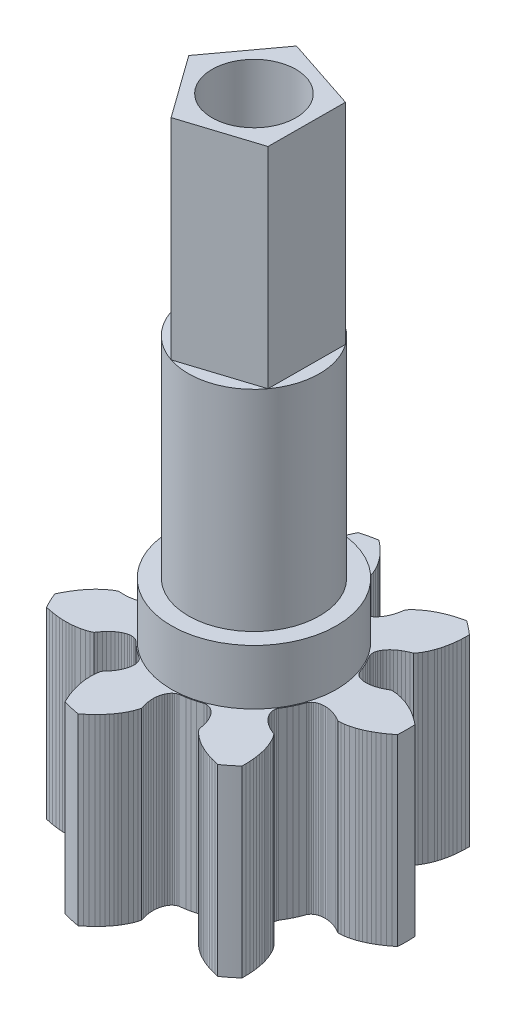
from build123d import *

# Parameters (mm, degrees)
SKETCH1_R           = 3.15
BOSS_EXTRUDE1_DEPTH = 2.1
SKETCH2_R           = 2.5
BOSS_EXTRUDE3_DEPTH = 16
BOSS_EXTRUDE4_DEPTH = 7
SKETCH3_R           = 1.1
SKETCH3_R_2         = 0.75
CUT_EXTRUDE2_DEPTH  = 20.858328167
SKETCH6_R           = 1.7
CUT_EXTRUDE3_DEPTH  = 7.6
SKETCH7_R           = 1.6
CUT_EXTRUDE4_DEPTH  = 20.313031807
SKETCH8_OUTSIDE_W   = 19.149
SKETCH8_OUTSIDE_H   = 19.428
CUT_EXTRUDE5_DEPTH  = 8


with BuildPart() as part:
    # Sketch1 → Boss-Extrude1 (new body)
    with BuildSketch(Plane(origin=(0, 0, 0), x_dir=(1, 0, 0), z_dir=(0, 1, 0))):
        with Locations(Location((0, 0, 0), (0, 0, 270))):
            Circle(SKETCH1_R)
    extrude(amount=BOSS_EXTRUDE1_DEPTH)

    # Sketch2 → Boss-Extrude3 (add)
    with BuildSketch(Plane(origin=(0, 2.1, 0), x_dir=(1, 0, 0), z_dir=(0, 1, 0))):
        with Locations(Location((0, 0, 0), (0, 0, 270))):
            Circle(SKETCH2_R)
    extrude(amount=BOSS_EXTRUDE3_DEPTH)

    # Sketch4 → Boss-Extrude4 (add)
    with BuildSketch(Plane.XZ):
        with BuildLine():
            Line((-1.677656104, -5.457545802), (-1.740166904, -5.314388502))
            Line((-1.740166904, -5.314388502), (-1.793915704, -5.175673402))
            Line((-1.793915704, -5.175673402), (-1.839244704, -5.042342702))
            Line((-1.839244704, -5.042342702), (-1.876421604, -4.915999102))
            Line((-1.876421604, -4.915999102), (-1.907053904, -4.793237402))
            Line((-1.907053904, -4.793237402), (-1.931099704, -4.676009702))
            Line((-1.931099704, -4.676009702), (-1.948773704, -4.566830802))
            Line((-1.948773704, -4.566830802), (-1.961024804, -4.464035702))
            Line((-1.961024804, -4.464035702), (-1.971502404, -4.279785302))
            Line((-1.971502404, -4.279785302), (-1.967365804, -4.124635702))
            Line((-1.967365804, -4.124635702), (-1.953730504, -4.000928102))
            Line((-1.953730504, -4.000928102), (-1.930260404, -3.886700602))
            Line((-1.930260404, -3.886700602), (-1.859391804, -3.809735002))
            Line((-1.859391804, -3.809735002), (-1.778417204, -3.712510502))
            Line((-1.778417204, -3.712510502), (-1.708697804, -3.615493902))
            Line((-1.708697804, -3.615493902), (-1.650076104, -3.519450202))
            Line((-1.650076104, -3.519450202), (-1.602332404, -3.425130202))
            Line((-1.602332404, -3.425130202), (-1.565200104, -3.333258302))
            Line((-1.565200104, -3.333258302), (-1.538382904, -3.244569502))
            Line((-1.538382904, -3.244569502), (-1.521548504, -3.159737902))
            Line((-1.521548504, -3.159737902), (-1.514299404, -3.079451802))
            Line((-1.514299404, -3.079451802), (-1.516222204, -3.004347502))
            Line((-1.516222204, -3.004347502), (-1.526863004, -2.935043002))
            Line((-1.526863004, -2.935043002), (-1.545721204, -2.872129302))
            Line((-1.545721204, -2.872129302), (-1.572279104, -2.816160102))
            Line((-1.572279104, -2.816160102), (-1.605971904, -2.767662302))
            Line((-1.605971904, -2.767662302), (-1.657232504, -2.718290402))
            Line((-1.657232504, -2.718290402), (-1.844744204, -2.592775302))
            Line((-1.844744204, -2.592775302), (-1.984007204, -2.487817902))
            Line((-1.984007204, -2.487817902), (-2.117322004, -2.375401802))
            Line((-2.117322004, -2.375401802), (-2.281415504, -2.220521102))
            Line((-2.281415504, -2.220521102), (-2.340956004, -2.181532002))
            Line((-2.340956004, -2.181532002), (-2.395735304, -2.159475702))
            Line((-2.395735304, -2.159475702), (-2.456210904, -2.146038102))
            Line((-2.456210904, -2.146038102), (-2.521743604, -2.141652302))
            Line((-2.521743604, -2.141652302), (-2.591678304, -2.146699902))
            Line((-2.591678304, -2.146699902), (-2.665327304, -2.161537602))
            Line((-2.665327304, -2.161537602), (-2.741987504, -2.186470302))
            Line((-2.741987504, -2.186470302), (-2.820946104, -2.221759402))
            Line((-2.820946104, -2.221759402), (-2.901443904, -2.267639402))
            Line((-2.901443904, -2.267639402), (-2.982749704, -2.324284202))
            Line((-2.982749704, -2.324284202), (-3.064080904, -2.391819002))
            Line((-3.064080904, -2.391819002), (-3.144672004, -2.470342602))
            Line((-3.144672004, -2.470342602), (-3.223742204, -2.559902302))
            Line((-3.223742204, -2.559902302), (-3.300510504, -2.660481102))
            Line((-3.300510504, -2.660481102), (-3.359776704, -2.746699402))
            Line((-3.359776704, -2.746699402), (-3.465917704, -2.794999002))
            Line((-3.465917704, -2.794999002), (-3.583489604, -2.835820002))
            Line((-3.583489604, -2.835820002), (-3.733828804, -2.874377002))
            Line((-3.733828804, -2.874377002), (-3.915791104, -2.905161502))
            Line((-3.915791104, -2.905161502), (-4.018735004, -2.916091602))
            Line((-4.018735004, -2.916091602), (-4.129109504, -2.923155402))
            Line((-4.129109504, -2.923155402), (-4.248748704, -2.925798102))
            Line((-4.248748704, -2.925798102), (-4.375248804, -2.923250802))
            Line((-4.375248804, -2.923250802), (-4.506697404, -2.915120202))
            Line((-4.506697404, -2.915120202), (-4.646771904, -2.900596502))
            Line((-4.646771904, -2.900596502), (-4.793969404, -2.879062302))
            Line((-4.793969404, -2.879062302), (-4.947447304, -2.849974302))
            Line((-4.947447304, -2.849974302), (-5.090225304, -2.816749202))
            ThreePointArc((-5.090225304, -2.816749202), (-5.241476502, -2.524161997), (-5.375926806, -2.223483907))
            Line((-5.375926806, -2.223483907), (-5.312882596, -2.091140098))
            Line((-5.312882596, -2.091140098), (-5.239932596, -1.953010098))
            Line((-5.239932596, -1.953010098), (-5.164992596, -1.824500098))
            Line((-5.164992596, -1.824500098), (-5.089012596, -1.705930098))
            Line((-5.089012596, -1.705930098), (-5.013412596, -1.598090098))
            Line((-5.013412596, -1.598090098), (-4.936532596, -1.497600098))
            Line((-4.936532596, -1.497600098), (-4.859872596, -1.405710098))
            Line((-4.859872596, -1.405710098), (-4.785532596, -1.323820098))
            Line((-4.785532596, -1.323820098), (-4.712802596, -1.250150098))
            Line((-4.712802596, -1.250150098), (-4.575282596, -1.127080098))
            Line((-4.575282596, -1.127080098), (-4.451402596, -1.033580098))
            Line((-4.451402596, -1.033580098), (-4.346182596, -0.967110098))
            Line((-4.346182596, -0.967110098), (-4.242242596, -0.914240098))
            Line((-4.242242596, -0.914240098), (-4.137882596, -0.921660098))
            Line((-4.137882596, -0.921660098), (-4.011382596, -0.924350098))
            Line((-4.011382596, -0.924350098), (-3.892062596, -0.918370098))
            Line((-3.892062596, -0.918370098), (-3.780422596, -0.904320098))
            Line((-3.780422596, -0.904320098), (-3.676912596, -0.882840098))
            Line((-3.676912596, -0.882840098), (-3.581932596, -0.854590098))
            Line((-3.581932596, -0.854590098), (-3.495872596, -0.820260098))
            Line((-3.495872596, -0.820260098), (-3.419052596, -0.780530098))
            Line((-3.419052596, -0.780530098), (-3.351762596, -0.736140098))
            Line((-3.351762596, -0.736140098), (-3.294242596, -0.687810098))
            Line((-3.294242596, -0.687810098), (-3.246692596, -0.636280098))
            Line((-3.246692596, -0.636280098), (-3.209262596, -0.582310098))
            Line((-3.209262596, -0.582310098), (-3.182062596, -0.526650098))
            Line((-3.182062596, -0.526650098), (-3.165152596, -0.470070098))
            Line((-3.165152596, -0.470070098), (-3.158512596, -0.399210098))
            Line((-3.158512596, -0.399210098), (-3.177292596, -0.174350098))
            Line((-3.177292596, -0.174350098), (-3.182062596, -3.0098e-05))
            Line((-3.182062596, -3.0098e-05), (-3.177292596, 0.174289902))
            Line((-3.177292596, 0.174289902), (-3.158512596, 0.399149902))
            Line((-3.158512596, 0.399149902), (-3.165152596, 0.470009902))
            Line((-3.165152596, 0.470009902), (-3.182062596, 0.526589902))
            Line((-3.182062596, 0.526589902), (-3.209262596, 0.582249902))
            Line((-3.209262596, 0.582249902), (-3.246692596, 0.636219902))
            Line((-3.246692596, 0.636219902), (-3.294242596, 0.687749902))
            Line((-3.294242596, 0.687749902), (-3.351762596, 0.736079902))
            Line((-3.351762596, 0.736079902), (-3.419052596, 0.780469902))
            Line((-3.419052596, 0.780469902), (-3.495872596, 0.820199902))
            Line((-3.495872596, 0.820199902), (-3.581932596, 0.854529902))
            Line((-3.581932596, 0.854529902), (-3.676912596, 0.882779902))
            Line((-3.676912596, 0.882779902), (-3.780422596, 0.904259902))
            Line((-3.780422596, 0.904259902), (-3.892062596, 0.918309902))
            Line((-3.892062596, 0.918309902), (-4.011382596, 0.924289902))
            Line((-4.011382596, 0.924289902), (-4.137882596, 0.921599902))
            Line((-4.137882596, 0.921599902), (-4.242242596, 0.914179902))
            Line((-4.242242596, 0.914179902), (-4.346182596, 0.967049902))
            Line((-4.346182596, 0.967049902), (-4.451402596, 1.033519902))
            Line((-4.451402596, 1.033519902), (-4.575282596, 1.127019902))
            Line((-4.575282596, 1.127019902), (-4.712802596, 1.250089902))
            Line((-4.712802596, 1.250089902), (-4.785532596, 1.323759902))
            Line((-4.785532596, 1.323759902), (-4.859872596, 1.405649902))
            Line((-4.859872596, 1.405649902), (-4.936532596, 1.497539902))
            Line((-4.936532596, 1.497539902), (-5.013412596, 1.598029902))
            Line((-5.013412596, 1.598029902), (-5.089012596, 1.705869902))
            Line((-5.089012596, 1.705869902), (-5.164992596, 1.824439902))
            Line((-5.164992596, 1.824439902), (-5.239932596, 1.952949902))
            Line((-5.239932596, 1.952949902), (-5.312882596, 2.091079902))
            Line((-5.312882596, 2.091079902), (-5.375926796, 2.223423702))
            ThreePointArc((-5.375926796, 2.223423702), (-5.241476491, 2.524101771), (-5.090225294, 2.816688957))
            Line((-5.090225294, 2.816688957), (-4.947447286, 2.849914054))
            Line((-4.947447286, 2.849914054), (-4.793969386, 2.879002054))
            Line((-4.793969386, 2.879002054), (-4.646771886, 2.900536254))
            Line((-4.646771886, 2.900536254), (-4.506697386, 2.915059954))
            Line((-4.506697386, 2.915059954), (-4.375248786, 2.923190554))
            Line((-4.375248786, 2.923190554), (-4.248748686, 2.925737854))
            Line((-4.248748686, 2.925737854), (-4.129109486, 2.923095154))
            Line((-4.129109486, 2.923095154), (-4.018734986, 2.916031354))
            Line((-4.018734986, 2.916031354), (-3.915791086, 2.905101254))
            Line((-3.915791086, 2.905101254), (-3.733828786, 2.874316754))
            Line((-3.733828786, 2.874316754), (-3.583489586, 2.835759754))
            Line((-3.583489586, 2.835759754), (-3.465917686, 2.794938754))
            Line((-3.465917686, 2.794938754), (-3.359776686, 2.746639154))
            Line((-3.359776686, 2.746639154), (-3.300510486, 2.660420854))
            Line((-3.300510486, 2.660420854), (-3.223742186, 2.559842054))
            Line((-3.223742186, 2.559842054), (-3.144671986, 2.470282354))
            Line((-3.144671986, 2.470282354), (-3.064080886, 2.391758754))
            Line((-3.064080886, 2.391758754), (-2.982749686, 2.324223954))
            Line((-2.982749686, 2.324223954), (-2.901443886, 2.267579154))
            Line((-2.901443886, 2.267579154), (-2.820946086, 2.221699154))
            Line((-2.820946086, 2.221699154), (-2.741987486, 2.186410054))
            Line((-2.741987486, 2.186410054), (-2.665327286, 2.161477354))
            Line((-2.665327286, 2.161477354), (-2.591678286, 2.146639654))
            Line((-2.591678286, 2.146639654), (-2.521743586, 2.141592054))
            Line((-2.521743586, 2.141592054), (-2.456210886, 2.145977854))
            Line((-2.456210886, 2.145977854), (-2.395735286, 2.159415454))
            Line((-2.395735286, 2.159415454), (-2.340955986, 2.181471754))
            Line((-2.340955986, 2.181471754), (-2.281415486, 2.220460854))
            Line((-2.281415486, 2.220460854), (-2.117321986, 2.375341554))
            Line((-2.117321986, 2.375341554), (-1.984007186, 2.487757654))
            Line((-1.984007186, 2.487757654), (-1.844744186, 2.592715054))
            Line((-1.844744186, 2.592715054), (-1.657232486, 2.718230154))
            Line((-1.657232486, 2.718230154), (-1.605971886, 2.767602054))
            Line((-1.605971886, 2.767602054), (-1.572279086, 2.816099854))
            Line((-1.572279086, 2.816099854), (-1.545721186, 2.872069054))
            Line((-1.545721186, 2.872069054), (-1.526862986, 2.934982754))
            Line((-1.526862986, 2.934982754), (-1.516222186, 3.004287254))
            Line((-1.516222186, 3.004287254), (-1.514299386, 3.079391554))
            Line((-1.514299386, 3.079391554), (-1.521548486, 3.159677654))
            Line((-1.521548486, 3.159677654), (-1.538382886, 3.244509254))
            Line((-1.538382886, 3.244509254), (-1.565200086, 3.333198054))
            Line((-1.565200086, 3.333198054), (-1.602332386, 3.425069954))
            Line((-1.602332386, 3.425069954), (-1.650076086, 3.519389954))
            Line((-1.650076086, 3.519389954), (-1.708697786, 3.615433654))
            Line((-1.708697786, 3.615433654), (-1.778417186, 3.712450254))
            Line((-1.778417186, 3.712450254), (-1.859391786, 3.809674754))
            Line((-1.859391786, 3.809674754), (-1.930260386, 3.886640354))
            Line((-1.930260386, 3.886640354), (-1.953730486, 4.000867854))
            Line((-1.953730486, 4.000867854), (-1.967365786, 4.124575454))
            Line((-1.967365786, 4.124575454), (-1.971502386, 4.279725054))
            Line((-1.971502386, 4.279725054), (-1.961024786, 4.463975454))
            Line((-1.961024786, 4.463975454), (-1.948773686, 4.566770554))
            Line((-1.948773686, 4.566770554), (-1.931099686, 4.675949454))
            Line((-1.931099686, 4.675949454), (-1.907053886, 4.793177154))
            Line((-1.907053886, 4.793177154), (-1.876421586, 4.915938854))
            Line((-1.876421586, 4.915938854), (-1.839244686, 5.042282454))
            Line((-1.839244686, 5.042282454), (-1.793915686, 5.175613154))
            Line((-1.793915686, 5.175613154), (-1.740166886, 5.314328254))
            Line((-1.740166886, 5.314328254), (-1.677656086, 5.457485554))
            Line((-1.677656086, 5.457485554), (-1.613492886, 5.589290554))
            ThreePointArc((-1.613492886, 5.589290554), (-1.294584924, 5.671642777), (-0.971527485, 5.735814951))
            Line((-0.971527485, 5.735814951), (-0.856530379, 5.644902123))
            Line((-0.856530379, 5.644902123), (-0.738096579, 5.543044323))
            Line((-0.738096579, 5.543044323), (-0.629484279, 5.441387023))
            Line((-0.629484279, 5.441387023), (-0.530794179, 5.340927723))
            Line((-0.530794179, 5.340927723), (-0.442480579, 5.243226523))
            Line((-0.442480579, 5.243226523), (-0.361617479, 5.145912923))
            Line((-0.361617479, 5.145912923), (-0.289089779, 5.050727423))
            Line((-0.289089779, 5.050727423), (-0.225795179, 4.960029123))
            Line((-0.225795179, 4.960029123), (-0.170156179, 4.872729423))
            Line((-0.170156179, 4.872729423), (-0.080772879, 4.711271723))
            Line((-0.080772879, 4.711271723), (-0.017182979, 4.569691923))
            Line((-0.017182979, 4.569691923), (0.024206821, 4.452319023))
            Line((0.024206821, 4.452319023), (0.052622421, 4.339220423))
            Line((0.052622421, 4.339220423), (0.022166221, 4.239128023))
            Line((0.022166221, 4.239128023), (-0.008605279, 4.116398223))
            Line((-0.008605279, 4.116398223), (-0.029326379, 3.998739123))
            Line((-0.029326379, 3.998739123), (-0.040470879, 3.886771723))
            Line((-0.040470879, 3.886771723), (-0.042562579, 3.781077223))
            Line((-0.042562579, 3.781077223), (-0.036155879, 3.682192323))
            Line((-0.036155879, 3.682192323), (-0.021836779, 3.590650923))
            Line((-0.021836779, 3.590650923), (-0.000196979, 3.506916223))
            Line((-0.000196979, 3.506916223), (0.028106621, 3.431435623))
            Line((0.028106621, 3.431435623), (0.062425521, 3.364603323))
            Line((0.062425521, 3.364603323), (0.102082621, 3.306779023))
            Line((0.102082621, 3.306779023), (0.146370621, 3.258277923))
            Line((0.146370621, 3.258277923), (0.194582521, 3.219374423))
            Line((0.194582521, 3.219374423), (0.245981121, 3.190298123))
            Line((0.245981121, 3.190298123), (0.313586921, 3.168056823))
            Line((0.313586921, 3.168056823), (0.536988121, 3.136329923))
            Line((0.536988121, 3.136329923), (0.707999021, 3.102190423))
            Line((0.707999021, 3.102190423), (0.876887021, 3.058750223))
            Line((0.876887021, 3.058750223), (1.091930421, 2.990405023))
            Line((1.091930421, 2.990405023), (1.162491321, 2.981110623))
            Line((1.162491321, 2.981110623), (1.221415521, 2.985006423))
            Line((1.221415521, 2.985006423), (1.281732621, 2.999139023))
            Line((1.281732621, 2.999139023), (1.342678421, 3.023621123))
            Line((1.342678421, 3.023621123), (1.403497321, 3.058512423))
            Line((1.403497321, 3.058512423), (1.463415021, 3.103835823))
            Line((1.463415021, 3.103835823), (1.521665521, 3.159561023))
            Line((1.521665521, 3.159561023), (1.577493421, 3.225614223))
            Line((1.577493421, 3.225614223), (1.630112821, 3.301877423))
            Line((1.630112821, 3.301877423), (1.678789621, 3.388189823))
            Line((1.678789621, 3.388189823), (1.722764221, 3.484324823))
            Line((1.722764221, 3.484324823), (1.761304221, 3.590039423))
            Line((1.761304221, 3.590039423), (1.793685421, 3.705037123))
            Line((1.793685421, 3.705037123), (1.819211821, 3.828964023))
            Line((1.819211821, 3.828964023), (1.835200121, 3.932358623))
            Line((1.835200121, 3.932358623), (1.909873421, 4.021928023))
            Line((1.909873421, 4.021928023), (1.998090521, 4.109718923))
            Line((1.998090521, 4.109718923), (2.116812121, 4.209687323))
            Line((2.116812121, 4.209687323), (2.267397621, 4.316373723))
            Line((2.267397621, 4.316373723), (2.355404521, 4.370887123))
            Line((2.355404521, 4.370887123), (2.451783521, 4.425141023))
            Line((2.451783521, 4.425141023), (2.558428121, 4.479431523))
            Line((2.558428121, 4.479431523), (2.673506021, 4.532022823))
            Line((2.673506021, 4.532022823), (2.795464821, 4.581730723))
            Line((2.795464821, 4.581730723), (2.927969221, 4.629421523))
            Line((2.927969221, 4.629421523), (3.069932921, 4.673886423))
            Line((3.069932921, 4.673886423), (3.220832621, 4.714270623))
            Line((3.220832621, 4.714270623), (3.363886921, 4.746284823))
            ThreePointArc((3.363886921, 4.746284823), (3.627108363, 4.548298309), (3.878703226, 4.335732528))
            Line((3.878703226, 4.335732528), (3.879324236, 4.189141042))
            Line((3.879324236, 4.189141042), (3.873530936, 4.033038442))
            Line((3.873530936, 4.033038442), (3.861770736, 3.884739642))
            Line((3.861770736, 3.884739642), (3.844760636, 3.744945242))
            Line((3.844760636, 3.744945242), (3.823437436, 3.614983242))
            Line((3.823437436, 3.614983242), (3.797771936, 3.491087842))
            Line((3.797771936, 3.491087842), (3.768573236, 3.375036342))
            Line((3.768573236, 3.375036342), (3.737125936, 3.269001042))
            Line((3.737125936, 3.269001042), (3.703562736, 3.171070342))
            Line((3.703562736, 3.171070342), (3.633059536, 3.000520342))
            Line((3.633059536, 3.000520342), (3.562015636, 2.862530242))
            Line((3.562015636, 2.862530242), (3.496055936, 2.756989642))
            Line((3.496055936, 2.756989642), (3.425348736, 2.664257542))
            Line((3.425348736, 2.664257542), (3.328104136, 2.625662642))
            Line((3.328104136, 2.625662642), (3.212964436, 2.573199942))
            Line((3.212964436, 2.573199942), (3.108055436, 2.516041142))
            Line((3.108055436, 2.516041142), (3.013567336, 2.454943742))
            Line((3.013567336, 2.454943742), (2.929627936, 2.390679642))
            Line((2.929627936, 2.390679642), (2.856311136, 2.324016942))
            Line((2.856311136, 2.324016942), (2.793668936, 2.255746642))
            Line((2.793668936, 2.255746642), (2.741694736, 2.186620242))
            Line((2.741694736, 2.186620242), (2.700328636, 2.117430142))
            Line((2.700328636, 2.117430142), (2.669474536, 2.048929342))
            Line((2.669474536, 2.048929342), (2.648991436, 1.981871242))
            Line((2.648991436, 1.981871242), (2.638684936, 1.917005642))
            Line((2.638684936, 1.917005642), (2.638328536, 1.855056142))
            Line((2.638328536, 1.855056142), (2.647642236, 1.796742342))
            Line((2.647642236, 1.796742342), (2.672404836, 1.730018642))
            Line((2.672404836, 1.730018642), (2.786888136, 1.535575142))
            Line((2.786888136, 1.535575142), (2.866820336, 1.380587942))
            Line((2.866820336, 1.380587942), (2.938157336, 1.221461342))
            Line((2.938157336, 1.221461342), (3.018800236, 1.010721142))
            Line((3.018800236, 1.010721142), (3.055527736, 0.949759542))
            Line((3.055527736, 0.949759542), (3.095312236, 0.906119642))
            Line((3.095312236, 0.906119642), (3.143968536, 0.867773342))
            Line((3.143968536, 0.867773342), (3.201108536, 0.835388342))
            Line((3.201108536, 0.835388342), (3.266307636, 0.809592642))
            Line((3.266307636, 0.809592642), (3.339100936, 0.791005742))
            Line((3.339100936, 0.791005742), (3.418987236, 0.780207842))
            Line((3.418987236, 0.780207842), (3.505437836, 0.777743242))
            Line((3.505437836, 0.777743242), (3.597870436, 0.784153042))
            Line((3.597870436, 0.784153042), (3.695701736, 0.799910942))
            Line((3.695701736, 0.799910942), (3.798280836, 0.825469442))
            Line((3.798280836, 0.825469442), (3.904961036, 0.861249642))
            Line((3.904961036, 0.861249642), (4.015059336, 0.907632842))
            Line((4.015059336, 0.907632842), (4.127864736, 0.964942742))
            Line((4.127864736, 0.964942742), (4.218670436, 1.016908042))
            Line((4.218670436, 1.016908042), (4.335256536, 1.014371642))
            Line((4.335256536, 1.014371642), (4.458896736, 1.000137542))
            Line((4.458896736, 1.000137542), (4.611076836, 0.969646442))
            Line((4.611076836, 0.969646442), (4.788376236, 0.918431942))
            Line((4.788376236, 0.918431942), (4.885867836, 0.883613842))
            Line((4.885867836, 0.883613842), (4.988376636, 0.842088442))
            Line((4.988376636, 0.842088442), (5.097314536, 0.792559942))
            Line((5.097314536, 0.792559942), (5.210181936, 0.735378542))
            Line((5.210181936, 0.735378542), (5.325085236, 0.671019742))
            Line((5.325085236, 0.671019742), (5.444986436, 0.597158342))
            Line((5.444986436, 0.597158342), (5.568263436, 0.513890042))
            Line((5.568263436, 0.513890042), (5.693921436, 0.421091042))
            Line((5.693921436, 0.421091042), (5.808144136, 0.329207242))
            ThreePointArc((5.808144136, 0.329207242), (5.817467929, -3.016e-05), (5.808144136, -0.329267562))
            Line((5.808144136, -0.329267562), (5.693921429, -0.421151358))
            Line((5.693921429, -0.421151358), (5.568263429, -0.513950358))
            Line((5.568263429, -0.513950358), (5.444986429, -0.597218658))
            Line((5.444986429, -0.597218658), (5.325085229, -0.671080058))
            Line((5.325085229, -0.671080058), (5.210181929, -0.735438858))
            Line((5.210181929, -0.735438858), (5.097314529, -0.792620258))
            Line((5.097314529, -0.792620258), (4.988376629, -0.842148758))
            Line((4.988376629, -0.842148758), (4.885867829, -0.883674158))
            Line((4.885867829, -0.883674158), (4.788376229, -0.918492258))
            Line((4.788376229, -0.918492258), (4.611076829, -0.969706758))
            Line((4.611076829, -0.969706758), (4.458896729, -1.000197858))
            Line((4.458896729, -1.000197858), (4.335256529, -1.014431958))
            Line((4.335256529, -1.014431958), (4.218670429, -1.016968358))
            Line((4.218670429, -1.016968358), (4.127864729, -0.965003058))
            Line((4.127864729, -0.965003058), (4.015059329, -0.907693158))
            Line((4.015059329, -0.907693158), (3.904961029, -0.861309958))
            Line((3.904961029, -0.861309958), (3.798280829, -0.825529758))
            Line((3.798280829, -0.825529758), (3.695701729, -0.799971258))
            Line((3.695701729, -0.799971258), (3.597870429, -0.784213358))
            Line((3.597870429, -0.784213358), (3.505437829, -0.777803558))
            Line((3.505437829, -0.777803558), (3.418987229, -0.780268158))
            Line((3.418987229, -0.780268158), (3.339100929, -0.791066058))
            Line((3.339100929, -0.791066058), (3.266307629, -0.809652958))
            Line((3.266307629, -0.809652958), (3.201108529, -0.835448658))
            Line((3.201108529, -0.835448658), (3.143968529, -0.867833658))
            Line((3.143968529, -0.867833658), (3.095312229, -0.906179958))
            Line((3.095312229, -0.906179958), (3.055527729, -0.949819858))
            Line((3.055527729, -0.949819858), (3.018800229, -1.010781458))
            Line((3.018800229, -1.010781458), (2.938157329, -1.221521658))
            Line((2.938157329, -1.221521658), (2.866820329, -1.380648258))
            Line((2.866820329, -1.380648258), (2.786888129, -1.535635458))
            Line((2.786888129, -1.535635458), (2.672404829, -1.730078958))
            Line((2.672404829, -1.730078958), (2.647642229, -1.796802658))
            Line((2.647642229, -1.796802658), (2.638328529, -1.855116458))
            Line((2.638328529, -1.855116458), (2.638684929, -1.917065958))
            Line((2.638684929, -1.917065958), (2.648991429, -1.981931558))
            Line((2.648991429, -1.981931558), (2.669474529, -2.048989658))
            Line((2.669474529, -2.048989658), (2.700328629, -2.117490458))
            Line((2.700328629, -2.117490458), (2.741694729, -2.186680558))
            Line((2.741694729, -2.186680558), (2.793668929, -2.255806958))
            Line((2.793668929, -2.255806958), (2.856311129, -2.324077258))
            Line((2.856311129, -2.324077258), (2.929627929, -2.390739958))
            Line((2.929627929, -2.390739958), (3.013567329, -2.455004058))
            Line((3.013567329, -2.455004058), (3.108055429, -2.516101458))
            Line((3.108055429, -2.516101458), (3.212964429, -2.573260258))
            Line((3.212964429, -2.573260258), (3.328104129, -2.625722958))
            Line((3.328104129, -2.625722958), (3.425348729, -2.664317858))
            Line((3.425348729, -2.664317858), (3.496055929, -2.757049958))
            Line((3.496055929, -2.757049958), (3.562015629, -2.862590558))
            Line((3.562015629, -2.862590558), (3.633059529, -3.000580658))
            Line((3.633059529, -3.000580658), (3.703562729, -3.171130658))
            Line((3.703562729, -3.171130658), (3.737125929, -3.269061358))
            Line((3.737125929, -3.269061358), (3.768573229, -3.375096658))
            Line((3.768573229, -3.375096658), (3.797771929, -3.491148158))
            Line((3.797771929, -3.491148158), (3.823437429, -3.615043558))
            Line((3.823437429, -3.615043558), (3.844760629, -3.745005558))
            Line((3.844760629, -3.745005558), (3.861770729, -3.884799958))
            Line((3.861770729, -3.884799958), (3.873530929, -4.033098758))
            Line((3.873530929, -4.033098758), (3.879324229, -4.189201358))
            Line((3.879324229, -4.189201358), (3.878703229, -4.335792858))
            ThreePointArc((3.878703229, -4.335792858), (3.627108367, -4.548358644), (3.363886927, -4.746345161))
            Line((3.363886927, -4.746345161), (3.220832594, -4.714330914))
            Line((3.220832594, -4.714330914), (3.069932894, -4.673946714))
            Line((3.069932894, -4.673946714), (2.927969194, -4.629481814))
            Line((2.927969194, -4.629481814), (2.795464794, -4.581791014))
            Line((2.795464794, -4.581791014), (2.673505994, -4.532083114))
            Line((2.673505994, -4.532083114), (2.558428094, -4.479491814))
            Line((2.558428094, -4.479491814), (2.451783494, -4.425201314))
            Line((2.451783494, -4.425201314), (2.355404494, -4.370947414))
            Line((2.355404494, -4.370947414), (2.267397594, -4.316434014))
            Line((2.267397594, -4.316434014), (2.116812094, -4.209747614))
            Line((2.116812094, -4.209747614), (1.998090494, -4.109779214))
            Line((1.998090494, -4.109779214), (1.909873394, -4.021988314))
            Line((1.909873394, -4.021988314), (1.835200094, -3.932418914))
            Line((1.835200094, -3.932418914), (1.819211794, -3.829024314))
            Line((1.819211794, -3.829024314), (1.793685394, -3.705097414))
            Line((1.793685394, -3.705097414), (1.761304194, -3.590099714))
            Line((1.761304194, -3.590099714), (1.722764194, -3.484385114))
            Line((1.722764194, -3.484385114), (1.678789594, -3.388250114))
            Line((1.678789594, -3.388250114), (1.630112794, -3.301937714))
            Line((1.630112794, -3.301937714), (1.577493394, -3.225674514))
            Line((1.577493394, -3.225674514), (1.521665494, -3.159621314))
            Line((1.521665494, -3.159621314), (1.463414994, -3.103896114))
            Line((1.463414994, -3.103896114), (1.403497294, -3.058572714))
            Line((1.403497294, -3.058572714), (1.342678394, -3.023681414))
            Line((1.342678394, -3.023681414), (1.281732594, -2.999199314))
            Line((1.281732594, -2.999199314), (1.221415494, -2.985066714))
            Line((1.221415494, -2.985066714), (1.162491294, -2.981170914))
            Line((1.162491294, -2.981170914), (1.091930394, -2.990465314))
            Line((1.091930394, -2.990465314), (0.876886994, -3.058810514))
            Line((0.876886994, -3.058810514), (0.707998994, -3.102250714))
            Line((0.707998994, -3.102250714), (0.536988094, -3.136390214))
            Line((0.536988094, -3.136390214), (0.313586894, -3.168117114))
            Line((0.313586894, -3.168117114), (0.245981094, -3.190358414))
            Line((0.245981094, -3.190358414), (0.194582494, -3.219434714))
            Line((0.194582494, -3.219434714), (0.146370594, -3.258338214))
            Line((0.146370594, -3.258338214), (0.102082594, -3.306839314))
            Line((0.102082594, -3.306839314), (0.062425494, -3.364663614))
            Line((0.062425494, -3.364663614), (0.028106594, -3.431495914))
            Line((0.028106594, -3.431495914), (-0.000197006, -3.506976514))
            Line((-0.000197006, -3.506976514), (-0.021836806, -3.590711214))
            Line((-0.021836806, -3.590711214), (-0.036155906, -3.682252614))
            Line((-0.036155906, -3.682252614), (-0.042562606, -3.781137514))
            Line((-0.042562606, -3.781137514), (-0.040470906, -3.886832014))
            Line((-0.040470906, -3.886832014), (-0.029326406, -3.998799414))
            Line((-0.029326406, -3.998799414), (-0.008605306, -4.116458514))
            Line((-0.008605306, -4.116458514), (0.022166194, -4.239188314))
            Line((0.022166194, -4.239188314), (0.052622394, -4.339280714))
            Line((0.052622394, -4.339280714), (0.024206794, -4.452379314))
            Line((0.024206794, -4.452379314), (-0.017183006, -4.569752214))
            Line((-0.017183006, -4.569752214), (-0.080772906, -4.711332014))
            Line((-0.080772906, -4.711332014), (-0.170156206, -4.872789714))
            Line((-0.170156206, -4.872789714), (-0.225795206, -4.960089414))
            Line((-0.225795206, -4.960089414), (-0.289089806, -5.050787714))
            Line((-0.289089806, -5.050787714), (-0.361617506, -5.145973214))
            Line((-0.361617506, -5.145973214), (-0.442480606, -5.243286814))
            Line((-0.442480606, -5.243286814), (-0.530794206, -5.340988014))
            Line((-0.530794206, -5.340988014), (-0.629484306, -5.441447314))
            Line((-0.629484306, -5.441447314), (-0.738096606, -5.543104614))
            Line((-0.738096606, -5.543104614), (-0.856530406, -5.644962414))
            Line((-0.856530406, -5.644962414), (-0.971527506, -5.735875214))
            ThreePointArc((-0.971527506, -5.735875214), (-1.294584942, -5.671703035), (-1.613492901, -5.589350807))
            Line((-1.613492901, -5.589350807), (-1.677656104, -5.457545802))
        make_face()
    extrude(amount=BOSS_EXTRUDE4_DEPTH)

    # Sketch3 → Cut-Extrude2 (cut, through all)
    # profile 1 of 2: a face of its own
    with BuildSketch(Plane.XZ):
        with Locations(Location((0, 0, 0), (0, 0, 90))):
            Circle(SKETCH3_R)
        Circle(SKETCH3_R_2, mode=Mode.SUBTRACT)
    # profile 2 of 2: a face of its own
    with BuildSketch(Plane.XZ):
        Circle(SKETCH3_R_2)
    extrude(amount=CUT_EXTRUDE2_DEPTH, mode=Mode.SUBTRACT)

    # Sketch6 → Cut-Extrude3 (cut)
    with BuildSketch(Plane.XZ.offset(7)):
        with Locations(Location((0, 0, 0), (0, 0, 270))):
            Circle(SKETCH6_R)
    extrude(amount=-CUT_EXTRUDE3_DEPTH, mode=Mode.SUBTRACT)

    # Sketch7 → Cut-Extrude4 (cut, through all)
    with BuildSketch(Plane.XZ.offset(-0.6)):
        with Locations(Location((0, 0, 0), (0, 0, 270))):
            Circle(SKETCH7_R)
    extrude(amount=-CUT_EXTRUDE4_DEPTH, mode=Mode.SUBTRACT)

    # Sketch8 outside → Cut-Extrude5 (cut)
    with BuildSketch(Plane(origin=(0, 18.1, 0), x_dir=(1, 0, 0), z_dir=(0, 1, 0))):
        with Locations((0.2205, 0)):
            Rectangle(SKETCH8_OUTSIDE_W, SKETCH8_OUTSIDE_H)
        Polygon((2.014525776, -1.480434361), (2.030499446, 1.45844849), (-0.759608104, 2.381805099), (-2.499963073, 0.013588015), (-0.785454045, -2.373407243), align=None, mode=Mode.SUBTRACT)
    extrude(amount=-CUT_EXTRUDE5_DEPTH, mode=Mode.SUBTRACT)


solid = part.part
